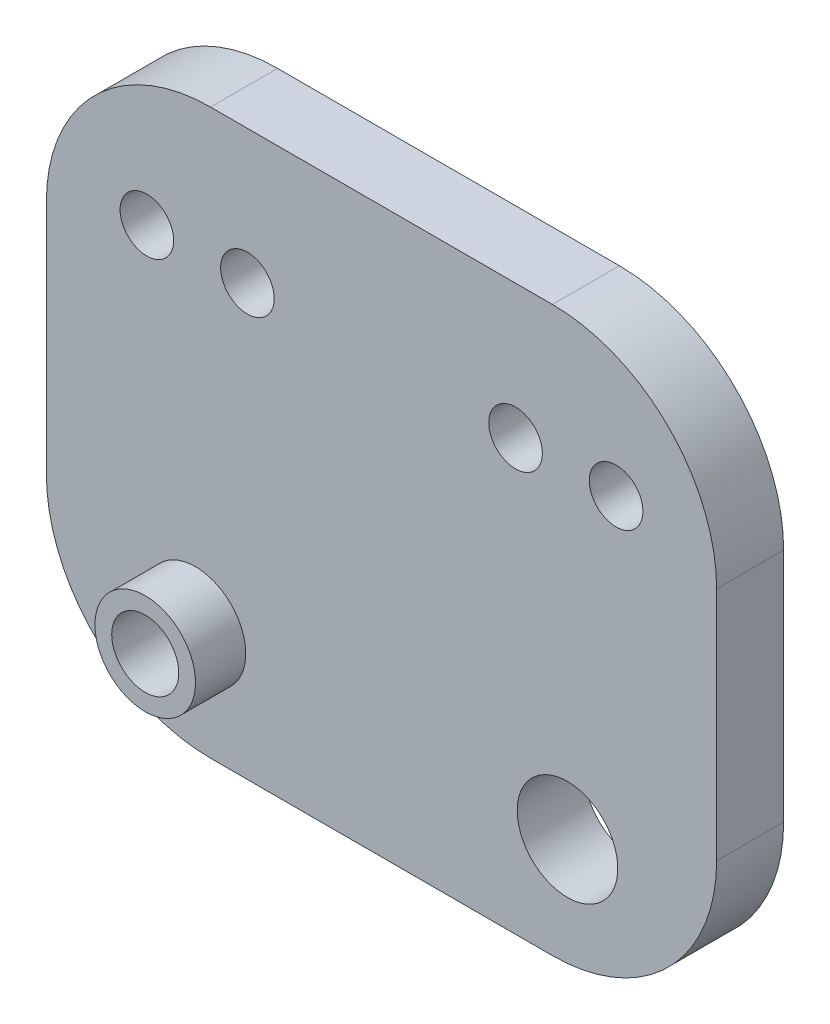
from build123d import *
from build123d.topology import SkipClean

# Parameters (mm, degrees)
SKETCH1_W                = 100
SKETCH1_H                = 50
BOSS_EXTRUDE1_DEPTH      = 6
SKETCH2_R                = 5
CUT_EXTRUDE1_DEPTH       = 57.222771187
MOVE_FACE2_BY            = 15
SKETCH3_W                = 100
SKETCH3_H                = 12
BOSS_EXTRUDE2_DEPTH      = 22
SKETCH4_R                = 2.5
BOSS_EXTRUDE3_DEPTH      = 20
SKETCH5_W                = 100
SKETCH5_H                = 56.133601368
BOSS_EXTRUDE4_DEPTH      = 10
SKETCH6_R                = 5
SKETCH6_R_2              = 2.5
CUT_EXTRUDE2_DEPTH       = 75.458041876
FILLET2_R                = 24.5
FILLET3_R                = 5
CUT_EXTRUDE3_DEPTH       = 48
MOVE_FACE3_BY            = 2.5
SKETCH10_R               = 4
CUT_EXTRUDE5_DEPTH       = 65.807406984
SKETCH13_R               = 7.5
SKETCH13_R_2             = 5
BOSS_EXTRUDE8_DEPTH      = 7.5
SKETCH14_R               = 5
BOSS_EXTRUDE9_DEPTH      = 10
SKETCH15_R               = 7.5
CUT_EXTRUDE6_DEPTH       = 4
MOVE_START               = 38
MOVE_FACE4_OUTLINE_R     = 7.5
MOVE_FACE4_OUTLINE_R_2   = 5
MOVE_FACE4_DEPTH         = 7.5
MOVE_START_2             = 28
MOVE_FACE4_2_DEPTH       = 10
MOVE_FACE4_3_OUTLINE_R   = 2.5
MOVE_FACE4_3_OUTLINE_R_2 = 7.5
MOVE_FACE4_3_DEPTH       = 10
MOVE_FACE4_4_OUTLINE_R   = 7.5
MOVE_FACE4_4_OUTLINE_R_2 = 5
MOVE_FACE4_4_DEPTH       = 7.5
MOVE_FACE5_DEPTH         = 10
CUT_EXTRUDE7_DEPTH       = 4
SKETCH17_W               = 33.141989336
SKETCH17_H               = 9.244353108
BOSS_EXTRUDE10_DEPTH     = 10


# Read off the part's stored shape, not the designer's step: Move Face4, Move Face5
with BuildPart() as part:
    # Sketch1 → Boss-Extrude1 (new body)
    with BuildSketch(Plane.XY):
        Rectangle(SKETCH1_W, SKETCH1_H)
    extrude(amount=BOSS_EXTRUDE1_DEPTH)

    # Sketch2 → Cut-Extrude1 (cut, through all)
    with BuildSketch(Plane.XY.offset(6)):
        with Locations((27.75, 0)):
            Circle(SKETCH2_R)
        with Locations((-27.75, 0)):
            Circle(SKETCH2_R)
    extrude(amount=-CUT_EXTRUDE1_DEPTH, mode=Mode.SUBTRACT)

    # Move Face2: a face moved outward by 15.0
    extrude(part.faces().sort_by_distance((0, 25, 3))[0], amount=MOVE_FACE2_BY, dir=(0, 1, 0))

    # Sketch3 → Boss-Extrude2 (add)
    with BuildSketch(Plane.XY.offset(6)):
        with Locations((0, 34)):
            Rectangle(SKETCH3_W, SKETCH3_H)
    extrude(amount=BOSS_EXTRUDE2_DEPTH)

    # Sketch4 → Boss-Extrude3 (add)
    with BuildSketch(Plane(origin=(0, 0, 0), x_dir=(-1, 0, 0), z_dir=(0, 0, -1))):
        with Locations((9.999238357, -9.892069005)):
            Circle(SKETCH4_R)
        with Locations((-10.000761643, -9.892069005)):
            Circle(SKETCH4_R)
    extrude(amount=BOSS_EXTRUDE3_DEPTH)

    # Sketch5 → Boss-Extrude4 (add)
    with BuildSketch(Plane.XY.offset(28)):
        with Locations((0, 11.933199316)):
            Rectangle(SKETCH5_W, SKETCH5_H)
    extrude(amount=BOSS_EXTRUDE4_DEPTH)

    # Sketch6 → Cut-Extrude2 (cut, through all)
    with BuildSketch(Plane(origin=(0, 0, 0), x_dir=(-1, 0, 0), z_dir=(0, 0, -1))):
        with Locations(Location((27.75, 0, 0), (0, 0, 180))):
            Circle(SKETCH6_R)
        with Locations((9.999238357, -9.892069005)):
            Circle(SKETCH6_R_2)
        with Locations((-10.000761643, -9.892069005)):
            Circle(SKETCH6_R_2)
        with Locations(Location((-27.75, 0, 0), (0, 0, 180))):
            Circle(SKETCH6_R)
    extrude(amount=-CUT_EXTRUDE2_DEPTH, mode=Mode.SUBTRACT)


with BuildPart() as cut_extrude2_piece_1:
    # of the separate pieces the step leaves, piece 1, a body of its own (cut_extrude2_pieces)
    add(part.part.solids().sort_by_distance((50, 40, 0))[0])

    # Fillet2
    # the kernel refuses this fillet: 24.5 mm, written as the material it takes off along each edge
    with BuildSketch(Plane(origin=(50, -16.133601368, -33.25), x_dir=(0, 1, 0), z_dir=(0, 0, 1))) as fillet2_piece_1_section:
        with BuildLine():
            CenterArc((FILLET2_R, FILLET2_R), FILLET2_R, 180, 90)
            Line((0, FILLET2_R), (0, 0))
            Line((0, 0), (FILLET2_R, 0))
        make_face()
    fillet2_piece_1 = extrude(amount=132.5, mode=Mode.PRIVATE)
    fillet2_piece_1 = split(fillet2_piece_1, bisect_by=Plane(origin=(44.527485496, -10.661086864, 6), z_dir=(0, 0, 1)), keep=Keep.TOP, mode=Mode.PRIVATE)
    add(fillet2_piece_1, mode=Mode.SUBTRACT)
    with BuildSketch(Plane(origin=(-50, 40, -61.25), x_dir=(1, 0, 0), z_dir=(0, 0, 1)), Plane(origin=(50, 40, -61.25), x_dir=(0, -1, 0), z_dir=(0, 0, 1))) as fillet2_piece_2:
        with BuildLine():
            CenterArc((FILLET2_R, -FILLET2_R), FILLET2_R, 90, 90)
            Line((0, -FILLET2_R), (0, 0))
            Line((0, 0), (FILLET2_R, 0))
        make_face()
    extrude(amount=160.5, mode=Mode.SUBTRACT)
    with BuildSketch(Plane(origin=(-50, -16.133601368, -33.25), x_dir=(1, 0, 0), z_dir=(0, 0, 1))) as fillet2_piece_3_section:
        with BuildLine():
            CenterArc((FILLET2_R, FILLET2_R), FILLET2_R, 180, 90)
            Line((0, FILLET2_R), (0, 0))
            Line((0, 0), (FILLET2_R, 0))
        make_face()
    fillet2_piece_3 = extrude(amount=132.5, mode=Mode.PRIVATE)
    fillet2_piece_3 = split(fillet2_piece_3, bisect_by=Plane(origin=(-44.527485496, -10.661086864, 6), z_dir=(0, 0, 1)), keep=Keep.TOP, mode=Mode.PRIVATE)
    add(fillet2_piece_3, mode=Mode.SUBTRACT)
    with BuildSketch(Plane(origin=(50, -25, -61.25), x_dir=(0, 1, 0), z_dir=(0, 0, 1)), Plane(origin=(-50, -25, -61.25), x_dir=(1, 0, 0), z_dir=(0, 0, 1))) as fillet2_piece_4:
        with BuildLine():
            CenterArc((FILLET2_R, FILLET2_R), FILLET2_R, 180, 90)
            Line((0, FILLET2_R), (0, 0))
            Line((0, 0), (FILLET2_R, 0))
        make_face()
    extrude(amount=128.5, mode=Mode.SUBTRACT)

    # Fillet3
    fillet3_edges = [cut_extrude2_piece_1.edges().sort_by_distance(p)[0] for p in [
        (46.571307506, 28, 17),
        (-46.571307506, 28, 17),
    ]]
    fillet(fillet3_edges, radius=FILLET3_R)


with BuildPart() as cut_extrude2_piece_2:
    # of the separate pieces the step leaves, piece 2, a body of its own (cut_extrude2_pieces)
    add(part.part.solids().sort_by_distance((-12.499238357, -9.892069005, -20))[0])


with BuildPart() as cut_extrude2_piece_3:
    # of the separate pieces the step leaves, piece 3, a body of its own (cut_extrude2_pieces)
    add(part.part.solids().sort_by_distance((7.500761643, -9.892069005, -20))[0])


with BuildPart() as cut_extrude3_tool:
    # Sketch8 → Cut-Extrude3 (new body)
    with BuildSketch(Plane(origin=(0, 0, -20), x_dir=(-1, 0, 0), z_dir=(0, 0, -1))):
        with BuildLine():
            Line((-50, 15.5), (-50, -0.5))
            ThreePointArc((-50, -0.5), (-42.824116139, -17.824116139), (-25.5, -25))
            Line((-25.5, -25), (25.5, -25))
            ThreePointArc((25.5, -25), (42.824116139, -17.824116139), (50, -0.5))
            Line((50, -0.5), (50, 15.5))
            ThreePointArc((50, 15.5), (42.824116139, 32.824116139), (25.5, 40))
            Line((25.5, 40), (-25.5, 40))
            ThreePointArc((-25.5, 40), (-42.824116139, 32.824116139), (-50, 15.5))
        make_face()
    extrude(amount=-CUT_EXTRUDE3_DEPTH)


with BuildPart() as cut_extrude2_piece_1_1:
    add(cut_extrude2_piece_1.part)

    # Cut-Extrude3: cut by cut_extrude3_tool
    add(cut_extrude3_tool.part, mode=Mode.SUBTRACT)

    # Move Face3: a curved face moved inward by 2.5
    add(Solid.thicken(cut_extrude2_piece_1_1.faces().sort_by_distance((22.75, 0, 33))[0], -MOVE_FACE3_BY), mode=Mode.SUBTRACT)

    # Sketch10 → Cut-Extrude5 (cut, through all)
    with BuildSketch(Plane.XY.offset(38)):
        with Locations((-35, 30)):
            Circle(SKETCH10_R)
        with Locations((35, 30)):
            Circle(SKETCH10_R)
        with Locations((-20, 30)):
            Circle(SKETCH10_R)
        with Locations((20, 30)):
            Circle(SKETCH10_R)
    extrude(amount=-CUT_EXTRUDE5_DEPTH, mode=Mode.SUBTRACT)

    # Sketch13 → Boss-Extrude8 (add)
    with SkipClean():  # the faces are left unmerged after this step: merging them gives an invalid solid
        with BuildSketch(Plane.XY.offset(38)):
            with Locations(Location((-27.75, 0, 0), (0, 0, 180))):
                Circle(SKETCH13_R)
            with Locations(Location((-27.75, 0, 0), (0, 0, 180))):
                Circle(SKETCH13_R_2, mode=Mode.SUBTRACT)
        extrude(amount=BOSS_EXTRUDE8_DEPTH)
    add(cut_extrude2_piece_1_1.part.scale(1), mode=Mode.REPLACE)  # the faces are merged on a copy

    # Sketch14 → Boss-Extrude9 (add)
    with BuildSketch(Plane(origin=(0, 0, 28), x_dir=(-1, 0, 0), z_dir=(0, 0, -1))):
        with Locations((27.75, 0)):
            Circle(SKETCH14_R)
    extrude(amount=-BOSS_EXTRUDE9_DEPTH)

    # Sketch15 → Cut-Extrude6 (cut)
    with BuildSketch(Plane(origin=(0, 0, 28), x_dir=(-1, 0, 0), z_dir=(0, 0, -1))):
        with Locations((-20, 30)):
            Circle(SKETCH15_R)
        with Locations((20, 30)):
            Circle(SKETCH15_R)
    extrude(amount=-CUT_EXTRUDE6_DEPTH, mode=Mode.SUBTRACT)

    # Move Face4 outline → Move Face4 (cut)
    with BuildSketch(Plane.XY.offset(MOVE_START)):
        with Locations((-27.75, 0)):
            Circle(MOVE_FACE4_OUTLINE_R)
        with Locations((-27.75, 0)):
            Circle(MOVE_FACE4_OUTLINE_R_2, mode=Mode.SUBTRACT)
    extrude(amount=MOVE_FACE4_DEPTH, mode=Mode.SUBTRACT)

    # Move Face4 2 outline → Move Face4 2 (cut)
    with BuildSketch(Plane.XY.offset(MOVE_START_2)):
        with BuildLine():
            ThreePointArc((34.368487141, -14.472163841), (26.858773605, -10.55314056), (20.485940794, -16.133601368))
            Line((20.485940794, -16.133601368), (25.5, -16.133601368))
            ThreePointArc((25.5, -16.133601368), (30.011386672, -15.714660113), (34.368487141, -14.472163841))
        make_face()
    extrude(amount=MOVE_FACE4_2_DEPTH, mode=Mode.SUBTRACT)

    # Move Face4 3 outline → Move Face4 3 (add)
    # profile 1 of 4: a face of its own
    with BuildSketch(Plane.XY.offset(MOVE_START_2)):
        with BuildLine():
            ThreePointArc((-25.5, -16.133601368), (-42.824116139, -8.957717507), (-50, 8.366398632))
            Line((-50, 8.366398632), (-50, -9.633601368))
            ThreePointArc((-50, -9.633601368), (-42.824116139, -26.957717507), (-25.5, -34.133601368))
            Line((-25.5, -34.133601368), (25.5, -34.133601368))
            ThreePointArc((25.5, -34.133601368), (42.824116139, -26.957717507), (50, -9.633601368))
            Line((50, -9.633601368), (50, 8.366398632))
            ThreePointArc((50, 8.366398632), (45.717912045, -5.471449196), (34.368487141, -14.472163841))
            ThreePointArc((34.368487141, -14.472163841), (28.641226395, -25.44685944), (20.485940794, -16.133601368))
            Line((20.485940794, -16.133601368), (-25.5, -16.133601368))
        make_face()
        with Locations((-9.999238357, -27.892069005)):
            Circle(MOVE_FACE4_3_OUTLINE_R, mode=Mode.SUBTRACT)
        with Locations((10.000761643, -27.892069005)):
            Circle(MOVE_FACE4_3_OUTLINE_R, mode=Mode.SUBTRACT)
    # profile 2 of 4: a face of its own
    with BuildSketch(Plane.XY.offset(MOVE_START_2)):
        with Locations((27.75, 0)):
            Circle(MOVE_FACE4_3_OUTLINE_R_2)
    # profile 3 of 4: a face of its own
    with BuildSketch(Plane.XY.offset(MOVE_START_2)):
        with Locations((10.000761643, -9.892069005)):
            Circle(MOVE_FACE4_3_OUTLINE_R)
    # profile 4 of 4: a face of its own
    with BuildSketch(Plane.XY.offset(MOVE_START_2)):
        with Locations((-9.999238357, -9.892069005)):
            Circle(MOVE_FACE4_3_OUTLINE_R)
    extrude(amount=MOVE_FACE4_3_DEPTH)

    # Move Face4 4 outline → Move Face4 4 (add)
    with BuildSketch(Plane.XY.offset(MOVE_START)):
        with Locations((-27.75, -18)):
            Circle(MOVE_FACE4_4_OUTLINE_R)
        with Locations((-27.75, -18)):
            Circle(MOVE_FACE4_4_OUTLINE_R_2, mode=Mode.SUBTRACT)
    extrude(amount=MOVE_FACE4_4_DEPTH)

    # Move Face5 outline → Move Face5 (add)
    with BuildSketch(Plane.XY.offset(MOVE_START_2)):
        with BuildLine():
            Line((25.5, 50), (-25.5, 50))
            ThreePointArc((-25.5, 50), (-42.824116139, 42.824116139), (-50, 25.5))
            Line((-50, 25.5), (-50, 15.5))
            ThreePointArc((-50, 15.5), (-42.824116139, 32.824116139), (-25.5, 40))
            Line((-25.5, 40), (25.5, 40))
            ThreePointArc((25.5, 40), (42.824116139, 32.824116139), (50, 15.5))
            Line((50, 15.5), (50, 25.5))
            ThreePointArc((50, 25.5), (42.824116139, 42.824116139), (25.5, 50))
        make_face()
    extrude(amount=MOVE_FACE5_DEPTH)

    # Sketch16 → Cut-Extrude7 (cut)
    with BuildSketch(Plane(origin=(0, 0, 28), x_dir=(-1, 0, 0), z_dir=(0, 0, -1))):
        with BuildLine():
            Line((-35, 37.5), (-20, 37.5))
            ThreePointArc((-20, 37.5), (-12.5, 30), (-20, 22.5))
            Line((-20, 22.5), (-35, 22.5))
            ThreePointArc((-35, 22.5), (-42.5, 30), (-35, 37.5))
        make_face()
        with BuildLine():
            Line((20, 37.5), (35, 37.5))
            ThreePointArc((35, 37.5), (42.5, 30), (35, 22.5))
            Line((35, 22.5), (20, 22.5))
            ThreePointArc((20, 22.5), (12.5, 30), (20, 37.5))
        make_face()
    extrude(amount=-CUT_EXTRUDE7_DEPTH, mode=Mode.SUBTRACT)

    # Sketch17 → Boss-Extrude10 (add)
    with BuildSketch(Plane(origin=(0, 0, 28), x_dir=(-1, 0, 0), z_dir=(0, 0, -1))):
        with Locations((-0.344204637, -27.66739457)):
            Rectangle(SKETCH17_W, SKETCH17_H)
    extrude(amount=-BOSS_EXTRUDE10_DEPTH)


with BuildPart() as cut_extrude2_piece_2_1:
    add(cut_extrude2_piece_2.part)

    # Cut-Extrude3: cut by cut_extrude3_tool
    add(cut_extrude3_tool.part, mode=Mode.SUBTRACT)


with BuildPart() as cut_extrude2_piece_3_1:
    add(cut_extrude2_piece_3.part)

    # Cut-Extrude3: cut by cut_extrude3_tool
    add(cut_extrude3_tool.part, mode=Mode.SUBTRACT)


solid = cut_extrude2_piece_1_1.part
